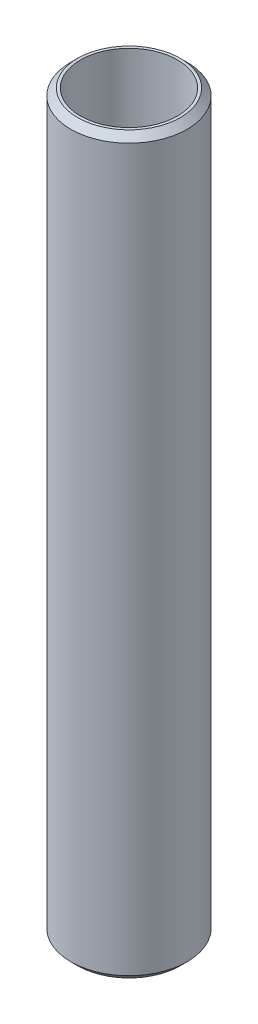
from build123d import *

# Parameters (mm, degrees)
SKETCH1_R           = 47.5
BOSS_EXTRUDE1_DEPTH = 600
SKETCH2_R           = 39.680543111
CUT_EXTRUDE1_DEPTH  = 604.748706003
CHAMFER1_SIZE       = 5.527262267


with BuildPart() as part:
    # Sketch1 → Boss-Extrude1 (new body)
    with BuildSketch(Plane(origin=(0, 0, 0), x_dir=(1, 0, 0), z_dir=(0, 1, 0))):
        Circle(SKETCH1_R)
    extrude(amount=BOSS_EXTRUDE1_DEPTH)

    # Sketch2 → Cut-Extrude1 (cut, through all)
    with BuildSketch(Plane(origin=(0, 0, 0), x_dir=(1, 0, 0), z_dir=(0, 1, 0))):
        Circle(SKETCH2_R)
    extrude(amount=CUT_EXTRUDE1_DEPTH, mode=Mode.SUBTRACT)

    # Chamfer1
    chamfer1_edges = [part.edges().sort_by_distance(p)[0] for p in [
        (-47.5, 600, 0),
        (-47.5, 0, 0),
    ]]
    chamfer(chamfer1_edges, length=CHAMFER1_SIZE)


solid = part.part
